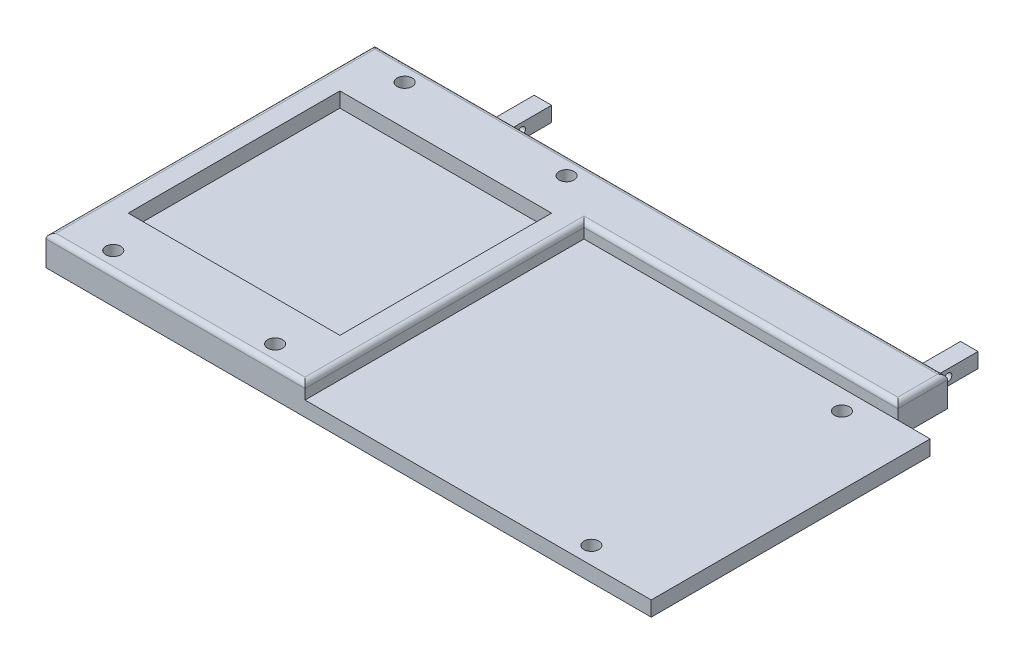
from build123d import *

# Parameters (mm, degrees)
SKETCH1_W           = 52
SKETCH1_H           = 66
BOSS_EXTRUDE1_DEPTH = 6
SKETCH2_W           = 42.5
SKETCH2_H           = 42.5
CUT_EXTRUDE1_DEPTH  = 3
SKETCH3_R           = 1.5
CUT_EXTRUDE2_DEPTH  = 13
SKETCH4_W           = 10
SKETCH4_H           = 6
BOSS_EXTRUDE2_DEPTH = 63
SKETCH5_W           = 3.5
SKETCH5_H           = 3
BOSS_EXTRUDE3_DEPTH = 10
SKETCH6_R           = 0.75
CUT_EXTRUDE3_DEPTH  = 114
SKETCH7_W           = 69.5
SKETCH7_H           = 56
SKETCH7_R           = 1.5
BOSS_EXTRUDE4_DEPTH = 3
FILLET1_R           = 1


with BuildPart() as part:
    # Sketch1 → Boss-Extrude1 (new body)
    with BuildSketch(Plane(origin=(0, 0, 0), x_dir=(1, 0, 0), z_dir=(0, 1, 0))):
        with Locations((-26, -33)):
            Rectangle(SKETCH1_W, SKETCH1_H)
    extrude(amount=BOSS_EXTRUDE1_DEPTH)

    # Sketch2 → Cut-Extrude1 (cut)
    with BuildSketch(Plane(origin=(0, 6, 0), x_dir=(1, 0, 0), z_dir=(0, 1, 0))):
        with Locations((-26, -33)):
            Rectangle(SKETCH2_W, SKETCH2_H)
    extrude(amount=-CUT_EXTRUDE1_DEPTH, mode=Mode.SUBTRACT)

    # Sketch3 → Cut-Extrude2 (cut)
    with BuildSketch(Plane(origin=(0, 6, 0), x_dir=(1, 0, 0), z_dir=(0, 1, 0))):
        with Locations((-42.25, -3.75)):
            Circle(SKETCH3_R)
        with Locations((-9.75, -3.75)):
            Circle(SKETCH3_R)
        with Locations((-9.75, -62.25)):
            Circle(SKETCH3_R)
        with Locations((-42.25, -62.25)):
            Circle(SKETCH3_R)
    extrude(amount=-CUT_EXTRUDE2_DEPTH, mode=Mode.SUBTRACT)

    # Sketch4 → Boss-Extrude2 (add)
    with BuildSketch(Plane(origin=(0, 0, 0), x_dir=(0, 0, -1), z_dir=(1, 0, 0))):
        with Locations((-5, 3)):
            Rectangle(SKETCH4_W, SKETCH4_H)
    extrude(amount=BOSS_EXTRUDE2_DEPTH)

    # Sketch5 → Boss-Extrude3 (add)
    with BuildSketch(Plane(origin=(0, 0, 0), x_dir=(-1, 0, 0), z_dir=(0, 0, -1))):
        with Locations((28.25, 1.5)):
            Rectangle(SKETCH5_W, SKETCH5_H)
        with Locations((-57.35, 1.5)):
            Rectangle(SKETCH5_W, SKETCH5_H)
    extrude(amount=BOSS_EXTRUDE3_DEPTH)

    # Sketch6 → Cut-Extrude3 (cut)
    with BuildSketch(Plane(origin=(59.1, 0, 0), x_dir=(0, 0, -1), z_dir=(1, 0, 0))):
        with Locations((4, 1.5)):
            Circle(SKETCH6_R)
    extrude(amount=-CUT_EXTRUDE3_DEPTH, mode=Mode.SUBTRACT)

    # Sketch7 → Boss-Extrude4 (add)
    with BuildSketch(Plane(origin=(0, 0, 0), x_dir=(-1, 0, 0), z_dir=(0, -1, 0))):
        with Locations((-34.75, -38)):
            Rectangle(SKETCH7_W, SKETCH7_H)
        with Locations((-55.8, -14.018024065)):
            Circle(SKETCH7_R, mode=Mode.SUBTRACT)
        with Locations((-54, -62.518024065)):
            Circle(SKETCH7_R, mode=Mode.SUBTRACT)
    extrude(amount=-BOSS_EXTRUDE4_DEPTH)

    # Fillet1
    fillet1_edges = [part.edges().sort_by_distance(p)[0] for p in [
        (63, 6, 5),
        (31.5, 6, 10),
        (0, 6, 38),
        (-26, 6, 66),
        (-52, 6, 33),
        (5.5, 6, 0),
    ]]
    fillet(fillet1_edges, radius=FILLET1_R)


solid = part.part
